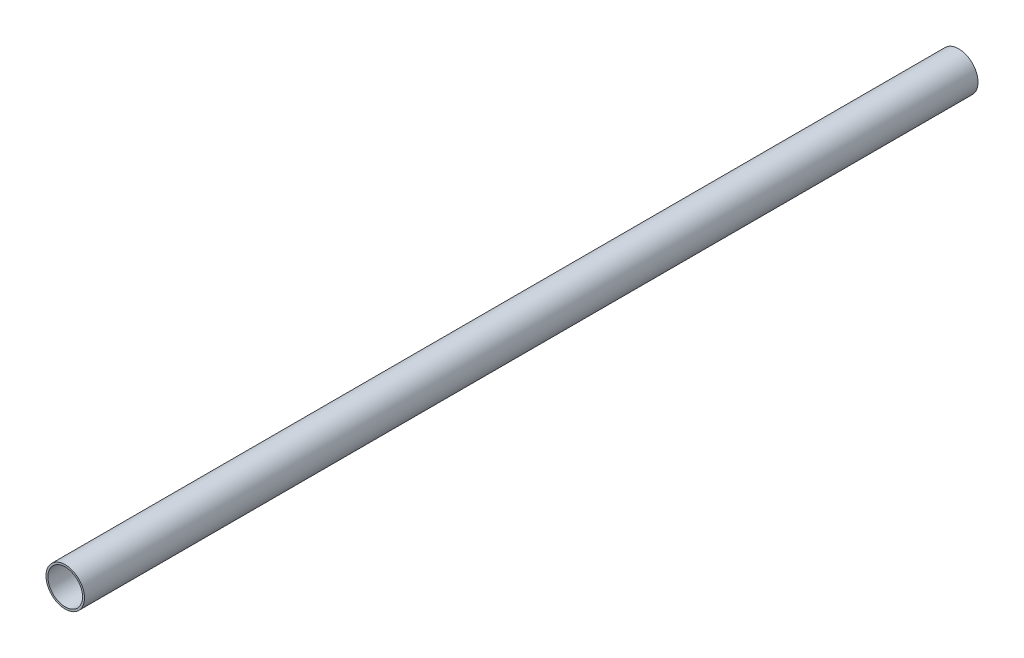
from build123d import *

# Parameters (mm, degrees)
SKETCH1_R           = 15
BOSS_EXTRUDE1_DEPTH = 696.02
SKETCH2_R           = 13.5
CUT_EXTRUDE1_DEPTH  = 697.343191537


with BuildPart() as part:
    # Sketch1 → Boss-Extrude1 (new body)
    with BuildSketch(Plane.XY):
        Circle(SKETCH1_R)
    extrude(amount=BOSS_EXTRUDE1_DEPTH)

    # Sketch2 → Cut-Extrude1 (cut, through all)
    with BuildSketch(Plane(origin=(0, 0, 0), x_dir=(-1, 0, 0), z_dir=(0, 0, -1))):
        Circle(SKETCH2_R)
    extrude(amount=-CUT_EXTRUDE1_DEPTH, mode=Mode.SUBTRACT)


solid = part.part
